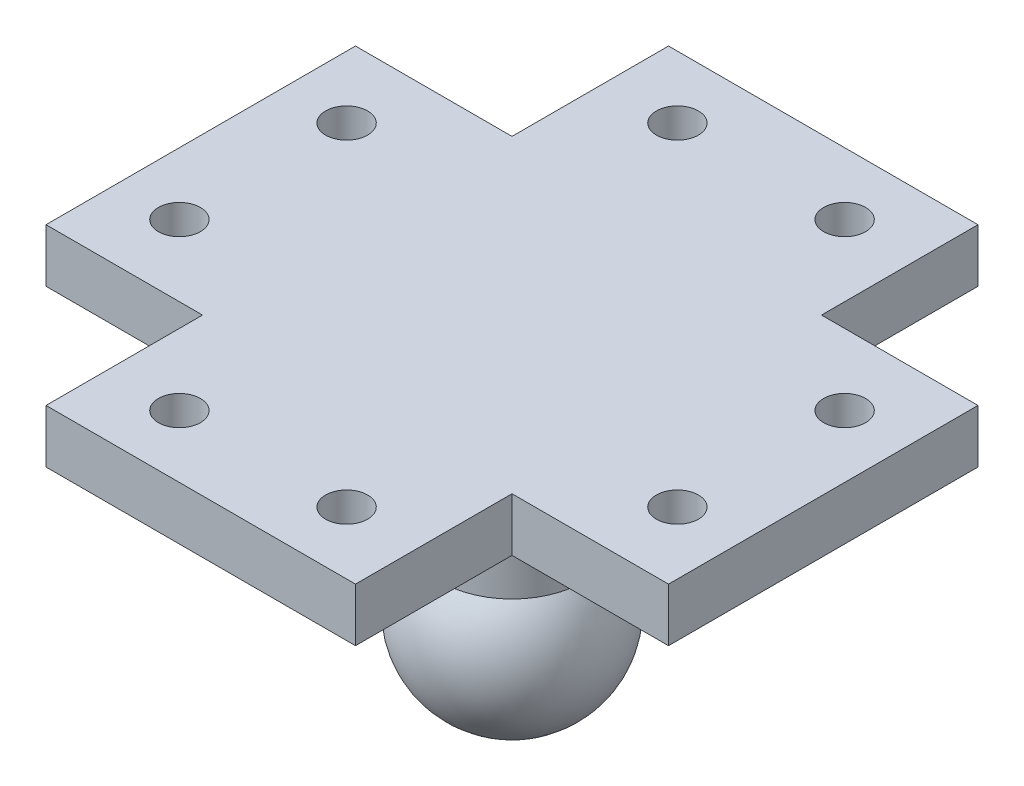
from build123d import *

# Parameters (mm, degrees)
SKETCH2_R           = 1.5
BOSS_EXTRUDE1_DEPTH = 3.81


with BuildPart() as part:
    # Sketch1 → Revolve3 (revolve)
    with BuildSketch(Plane.XY):
        with BuildLine():
            ThreePointArc((-5.08, 4.219764922), (-5.978300074, -2.805841091), (0, -6.604))
            Line((0, -6.604), (0, 6.604))
            Line((0, 6.604), (0, 14.379764922))
            Line((0, 14.379764922), (-5.08, 14.379764922))
            Line((-5.08, 14.379764922), (-5.08, 4.219764922))
        make_face()
    revolve(axis=Axis((0, -6.604, 0), (0, 1, 0)))

    # Sketch2 → Boss-Extrude1 (add)
    with BuildSketch(Plane(origin=(0, 14.379764922, 0), x_dir=(1, 0, 0), z_dir=(0, 1, 0))):
        Polygon((-11.049, 11.049), (-22.225, 11.049), (-22.225, -11.049), (-11.049, -11.049), (-11.049, -22.225), (11.049, -22.225), (11.049, -11.049), (22.225, -11.049), (22.225, 11.049), (11.049, 11.049), (11.049, 22.225), (-11.049, 22.225), align=None)
        with Locations((-17.78, -5.969)):
            Circle(SKETCH2_R, mode=Mode.SUBTRACT)
        with Locations((-17.78, 5.969)):
            Circle(SKETCH2_R, mode=Mode.SUBTRACT)
        with Locations((5.969, 17.78)):
            Circle(SKETCH2_R, mode=Mode.SUBTRACT)
        with Locations((-5.969, 17.78)):
            Circle(SKETCH2_R, mode=Mode.SUBTRACT)
        with Locations((17.78, 5.969)):
            Circle(SKETCH2_R, mode=Mode.SUBTRACT)
        with Locations((17.78, -5.969)):
            Circle(SKETCH2_R, mode=Mode.SUBTRACT)
        with Locations((5.969, -17.78)):
            Circle(SKETCH2_R, mode=Mode.SUBTRACT)
        with Locations((-5.969, -17.78)):
            Circle(SKETCH2_R, mode=Mode.SUBTRACT)
    extrude(amount=BOSS_EXTRUDE1_DEPTH)


solid = part.part
